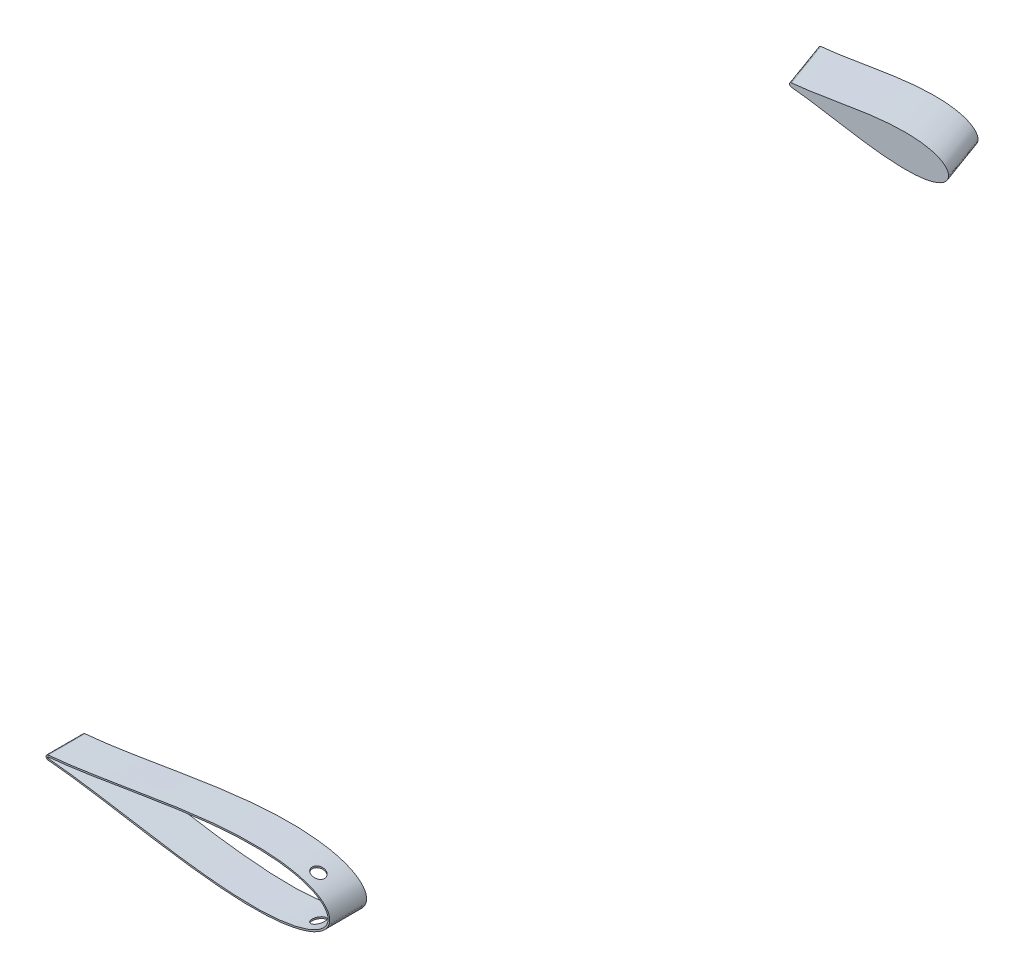
from build123d import *

# Parameters (mm, degrees)
BOSS_EXTRUDE1_DEPTH     = 50.8
BOSS_EXTRUDE2_DEPTH     = 38.1
CUT_EXTRUDE1_DEPTH      = 1080.51113169
CUT_EXTRUDE1_DEPTH_BACK = 1080.51113169
SKETCH17_R              = 6.35


with BuildPart() as part:
    # Sketch14 → Boss-Extrude1 (new, along a direction that is not the sketch's normal)
    with BuildSketch(Plane(origin=(0, 0, -947.42), x_dir=(-1, 0, 0), z_dir=(0, 0, -1))):
        with BuildLine():
            add(Edge.make_bspline(
                [(91.352087234, 1.49541842), (89.598575501, 1.641352156), (87.84757384, 1.812842005), (84.349691548, 2.189510256), (82.60270955, 2.394793371), (77.366117711, 3.048311358), (73.881345638, 3.534402047), (63.442435819, 5.077993959), (56.500977489, 6.219849924), (42.621199436, 8.523433908), (35.680956998, 9.687776942), (21.790883066, 11.873887804), (14.842692676, 12.896557742), (0.932047195, 14.623504691), (-6.03030017, 15.330186144), (-16.492434268, 15.974758747), (-19.982944122, 16.119712973), (-26.972274324, 16.224128381), (-30.471073998, 16.184051004), (-37.480122502, 15.848347235), (-40.990291409, 15.554504723), (-46.268500779, 14.824558439), (-48.030093019, 14.532381203), (-51.559091221, 13.818262461), (-53.332778194, 13.39435861), (-56.81146016, 12.38516863), (-58.523976644, 11.800078843), (-61.033001178, 10.743146143), (-61.860775343, 10.359638132), (-63.469588254, 9.525567587), (-64.252857703, 9.07430022), (-65.386488712, 8.330555883), (-65.757383951, 8.071333903), (-66.482980045, 7.526662589), (-66.838642257, 7.240627145), (-67.870162309, 6.339614528), (-68.503290084, 5.689498103), (-69.341767797, 4.613528965), (-69.603838166, 4.235106398), (-70.071556129, 3.453206694), (-70.277873939, 3.049537686), (-70.628606385, 2.21361134), (-70.773656939, 1.778714067), (-70.987538653, 0.887201521), (-71.055954682, 0.435999403), (-71.09733606, -0.249461), (-71.100793871, -0.479388301), (-71.087511786, -0.93348962), (-71.070859023, -1.159056852), (-70.991460569, -1.831396427), (-70.899187483, -2.273793723), (-70.640532758, -3.14760772), (-70.475581679, -3.572246507), (-70.088007778, -4.388992776), (-69.864686081, -4.783043296), (-69.116569875, -5.927296162), (-68.532975764, -6.614815004), (-67.572464514, -7.56238959), (-67.237640667, -7.864431581), (-66.543070745, -8.445017267), (-66.183270217, -8.72316135), (-65.08619603, -9.515199424), (-64.32647796, -9.992300117), (-62.765321419, -10.871520821), (-61.963717738, -11.273343914), (-60.327372807, -12.017434644), (-59.489741235, -12.360515785), (-57.80489415, -12.990962045), (-56.956987388, -13.278794674), (-54.399943476, -14.075736632), (-52.677619498, -14.518973377), (-49.207585255, -15.278633935), (-47.45976162, -15.594491432), (-43.944119467, -16.126325344), (-42.176307489, -16.342334436), (-38.624253029, -16.69227679), (-36.836817967, -16.826466647), (-31.489740778, -17.123805508), (-27.937606149, -17.184757259), (-20.851131898, -17.11253393), (-17.316850695, -16.978721535), (-6.733997676, -16.359205774), (0.294850171, -15.658332391), (14.323068904, -13.93501961), (21.322183333, -12.909782508), (35.307159142, -10.714729973), (42.292847895, -9.543501426), (56.266293626, -7.22367809), (63.254380531, -6.072666851), (73.762599821, -4.516381619), (77.269732876, -4.026286331), (82.542091663, -3.367220314), (84.301469316, -3.160156997), (87.823714895, -2.780379732), (89.586699962, -2.607549728), (91.352088815, -2.460626522)],
                knots=[0, 0, 0, 0, 0.015625, 0.015625, 0.03125, 0.03125, 0.0625, 0.0625, 0.125, 0.125, 0.1875, 0.1875, 0.25, 0.25, 0.3125, 0.3125, 0.34375, 0.34375, 0.375, 0.375, 0.40625, 0.40625, 0.421875, 0.421875, 0.4375, 0.4375, 0.453125, 0.453125, 0.4609375, 0.4609375, 0.46875, 0.46875, 0.47265625, 0.47265625, 0.4765625, 0.4765625, 0.484375, 0.484375, 0.48828125, 0.48828125, 0.4921875, 0.4921875, 0.49609375, 0.49609375, 0.5, 0.5, 0.501953125, 0.501953125, 0.50390625, 0.50390625, 0.5078125, 0.5078125, 0.51171875, 0.51171875, 0.515625, 0.515625, 0.5234375, 0.5234375, 0.52734375, 0.52734375, 0.53125, 0.53125, 0.5390625, 0.5390625, 0.546875, 0.546875, 0.5546875, 0.5546875, 0.5625, 0.5625, 0.578125, 0.578125, 0.59375, 0.59375, 0.609375, 0.609375, 0.625, 0.625, 0.65625, 0.65625, 0.6875, 0.6875, 0.75, 0.75, 0.8125, 0.8125, 0.875, 0.875, 0.9375, 0.9375, 0.96875, 0.96875, 0.984375, 0.984375, 1, 1, 1, 1], degree=3))
            add(Edge.make_bspline(
                [(91.352088815, -2.460626522), (91.601247742, -2.439890451), (91.849197057, -2.376468765), (92.18880923, -2.219052744), (92.298566645, -2.155739312), (92.503716216, -2.010702376), (92.598582666, -1.929649142), (92.772689152, -1.75024091), (92.852401369, -1.650826041), (92.989580407, -1.441620182), (93.047845804, -1.331306778), (93.143281403, -1.099011797), (93.179933567, -0.977495102), (93.22850444, -0.732835486), (93.240978628, -0.608480951), (93.240891061, -0.355480127), (93.228326558, -0.231145286), (93.179631515, 0.013317034), (93.142976371, 0.13463695), (93.047364892, 0.367010351), (92.989077395, 0.477174159), (92.852169859, 0.685818552), (92.772495618, 0.785201718), (92.59817063, 0.964768542), (92.5034611, 1.045594206), (92.299432218, 1.189904809), (92.189172384, 1.253624091), (91.962450056, 1.35875365), (91.845186395, 1.400916145), (91.602860105, 1.464452629), (91.47748787, 1.484982115), (91.352087234, 1.49541842)],
                knots=[0, 0, 0, 0, 0.125, 0.125, 0.1875, 0.1875, 0.25, 0.25, 0.3125, 0.3125, 0.375, 0.375, 0.4375, 0.4375, 0.5, 0.5, 0.5625, 0.5625, 0.625, 0.625, 0.6875, 0.6875, 0.75, 0.75, 0.8125, 0.8125, 0.875, 0.875, 0.9375, 0.9375, 1, 1, 1, 1], degree=3))
        make_face()
    extrude(amount=BOSS_EXTRUDE1_DEPTH, dir=(-0.34202014332566943, 0, -0.9396926207859082))


with BuildPart() as body_2:
    # Sketch16 → Boss-Extrude2 (new body)
    with BuildSketch(Plane.XY):
        with BuildLine():
            add(Edge.make_bspline(
                [(126.365289106, -2.776557685), (129.533195406, -3.039999805), (132.696832827, -3.349909436), (139.017244919, -4.030084797), (142.174533676, -4.400555914), (151.635672652, -5.581277396), (157.929755345, -6.459545262), (170.502922826, -8.318500411), (176.781776085, -9.300768785), (189.33176488, -11.318009225), (195.602945233, -12.353196054), (214.415538932, -15.475602914), (226.954876281, -17.579089337), (252.061956075, -21.526190816), (264.62941354, -23.372413076), (283.528249756, -25.705807947), (289.83584901, -26.41053343), (302.472548515, -27.623276975), (308.801627899, -28.13148593), (321.488293166, -28.887104763), (327.845831051, -29.134953757), (337.410880848, -29.243764762), (340.604060239, -29.235851542), (345.402366531, -29.145876878), (347.003231889, -29.102803264), (350.208087487, -28.988067245), (351.8124368, -28.916412441), (356.618340905, -28.655142936), (359.816519315, -28.419166413), (366.199054484, -27.798865851), (369.383411367, -27.414543141), (375.734902204, -26.461044365), (378.889840316, -25.893834969), (385.138376828, -24.529653187), (388.233406208, -23.733690042), (392.81539744, -22.3039193), (394.33257298, -21.787780403), (397.341884883, -20.657986295), (398.835193011, -20.043896325), (401.759152777, -18.706036944), (403.193526133, -17.981720223), (405.29083459, -16.786400085), (405.982303808, -16.368675404), (407.335989268, -15.496392815), (407.997647095, -15.042114637), (409.929580021, -13.615928339), (411.149105569, -12.583404835), (412.550174006, -11.145434664), (412.824077263, -10.850303438), (413.357840179, -10.243267277), (413.618133766, -9.930713918), (414.367024496, -8.976388176), (414.826521275, -8.315194202), (415.444344344, -7.278540815), (415.638340795, -6.925486931), (416.000182434, -6.202952749), (416.168649945, -5.831873173), (416.625348359, -4.704174857), (416.864670193, -3.936039024), (417.11718589, -2.757135142), (417.183369199, -2.359655948), (417.277848046, -1.555195949), (417.306168146, -1.147421147), (417.331406111, 0.07455601), (417.268822492, 0.868656829), (417.002632394, 2.430557035), (416.798379162, 3.19688277), (416.3924011, 4.325902031), (416.239698995, 4.700518075), (415.907808028, 5.431048376), (415.728471122, 5.787804936), (415.154114269, 6.834981146), (414.722878882, 7.502390368), (414.014880757, 8.464654095), (413.768663418, 8.778916419), (413.257411307, 9.395484919), (412.99201273, 9.698169953), (411.636056735, 11.167993887), (410.448798565, 12.218974516), (408.564510879, 13.669461782), (407.918719061, 14.131396723), (406.596151454, 15.017515557), (405.917562671, 15.442749606), (403.858717927, 16.659751369), (402.454280606, 17.393859781), (399.597885708, 18.746942463), (398.14572581, 19.365426542), (395.203279761, 20.510020756), (393.712920978, 21.035954915), (390.70042534, 22.010829941), (389.175817693, 22.460341364), (384.577889987, 23.705379764), (381.499752589, 24.394318076), (375.324802931, 25.56718905), (372.227906094, 26.050193278), (366.019425804, 26.854977547), (362.907805738, 27.176355687), (356.672517481, 27.686852163), (353.548837654, 27.875842759), (344.162576846, 28.275720541), (337.884924457, 28.32115946), (328.446017751, 28.143110327), (325.296308521, 28.042294715), (319.01174376, 27.769483533), (315.873942015, 27.597469422), (306.472184034, 26.988863989), (300.219806177, 26.460256932), (287.738352204, 25.217859119), (281.509303178, 24.503853081), (262.848148034, 22.155271774), (250.441855426, 20.315551274), (225.659016065, 16.399713896), (213.282778285, 14.321141556), (194.713663919, 11.241093422), (188.523166439, 10.220856456), (176.134542365, 8.2337803), (169.936465833, 7.266886467), (157.525568837, 5.437453024), (151.312951941, 4.573472608), (141.975067213, 3.41169221), (138.859231402, 3.047134526), (132.619207486, 2.377134804), (129.494429459, 2.071576746), (126.365289029, 1.811358381)],
                knots=[0, 0, 0, 0, 0.015625, 0.015625, 0.03125, 0.03125, 0.0625, 0.0625, 0.09375, 0.09375, 0.125, 0.125, 0.1875, 0.1875, 0.25, 0.25, 0.28125, 0.28125, 0.3125, 0.3125, 0.34375, 0.34375, 0.359375, 0.359375, 0.3671875, 0.3671875, 0.375, 0.375, 0.390625, 0.390625, 0.40625, 0.40625, 0.421875, 0.421875, 0.4375, 0.4375, 0.4453125, 0.4453125, 0.453125, 0.453125, 0.4609375, 0.4609375, 0.46484375, 0.46484375, 0.46875, 0.46875, 0.4765625, 0.4765625, 0.478515625, 0.478515625, 0.48046875, 0.48046875, 0.484375, 0.484375, 0.486328125, 0.486328125, 0.48828125, 0.48828125, 0.4921875, 0.4921875, 0.494140625, 0.494140625, 0.49609375, 0.49609375, 0.5, 0.5, 0.50390625, 0.50390625, 0.505859375, 0.505859375, 0.5078125, 0.5078125, 0.51171875, 0.51171875, 0.513671875, 0.513671875, 0.515625, 0.515625, 0.5234375, 0.5234375, 0.52734375, 0.52734375, 0.53125, 0.53125, 0.5390625, 0.5390625, 0.546875, 0.546875, 0.5546875, 0.5546875, 0.5625, 0.5625, 0.578125, 0.578125, 0.59375, 0.59375, 0.609375, 0.609375, 0.625, 0.625, 0.65625, 0.65625, 0.671875, 0.671875, 0.6875, 0.6875, 0.71875, 0.71875, 0.75, 0.75, 0.8125, 0.8125, 0.875, 0.875, 0.90625, 0.90625, 0.9375, 0.9375, 0.96875, 0.96875, 0.984375, 0.984375, 1, 1, 1, 1], degree=3))
            add(Edge.make_bspline(
                [(126.365289029, 1.811358381), (126.082445832, 1.787837226), (125.800752517, 1.709726316), (125.29039887, 1.460494173), (125.05556253, 1.286378206), (124.766818062, 0.973119594), (124.679275152, 0.858155233), (124.528023209, 0.615400299), (124.464404725, 0.488376051), (124.360685292, 0.223267924), (124.320505575, 0.083978407), (124.267260922, -0.196726404), (124.253681496, -0.33888649), (124.253718192, -0.62693294), (124.26733093, -0.768624911), (124.320161865, -1.047617863), (124.359843326, -1.186035748), (124.464042919, -1.452920662), (124.527732278, -1.579937653), (124.677909089, -1.821331957), (124.765533297, -1.936790461), (124.958780327, -2.146701121), (125.06429659, -2.241617512), (125.292743675, -2.411791159), (125.41663599, -2.487260057), (125.672311377, -2.612285902), (125.805074262, -2.662774505), (126.080651347, -2.739212523), (126.22295353, -2.764721102), (126.365289106, -2.776557685)],
                knots=[0, 0, 0, 0, 0.125, 0.125, 0.25, 0.25, 0.3125, 0.3125, 0.375, 0.375, 0.4375, 0.4375, 0.5, 0.5, 0.5625, 0.5625, 0.625, 0.625, 0.6875, 0.6875, 0.75, 0.75, 0.8125, 0.8125, 0.875, 0.875, 0.9375, 0.9375, 1, 1, 1, 1], degree=3))
        make_face()
        with BuildLine():
            ThreePointArc((126.496851059, 0.229317599), (125.841678869, -0.482600009), (126.496851077, -1.194517601))
            add(Edge.make_bspline(
                [(126.496851077, -1.194517601), (126.729706694, -1.213881784), (128.484555461, -1.361695883), (131.940515396, -1.681123472), (137.070377367, -2.214764149), (142.757988423, -2.869593043), (148.981968122, -3.649535708), (155.713278911, -4.555386266), (162.922811423, -5.585113831), (170.579345778, -6.733399419), (178.650368608, -7.992074339), (187.102067049, -9.349900248), (195.899513624, -10.79285267), (205.006767773, -12.304296227), (214.386992306, -13.865153344), (224.002515129, -15.454245854), (233.814891207, -17.048549245), (243.784934969, -18.623570085), (253.872741551, -20.15367614), (264.037688386, -21.612551356), (274.238439962, -22.973529753), (284.432937787, -24.210070717), (294.578393406, -25.296140455), (304.631281861, -26.206671723), (314.54734585, -26.917929489), (324.281596584, -27.407954765), (333.788323577, -27.656977764), (343.021110192, -27.647732596), (351.932818031, -27.365553121), (360.475586196, -26.799391147), (368.600692212, -25.94103677), (376.258474868, -24.78662084), (383.397870016, -23.335738401), (389.966063878, -21.59324438), (395.907528805, -19.569351107), (401.162992896, -17.282091813), (405.668634935, -14.761754902), (409.357142668, -12.059485448), (412.166405834, -9.263543434), (414.068321899, -6.521759489), (415.128883301, -4.048125246), (415.557158042, -2.063808477), (415.654701473, -0.4826), (415.557158042, 1.098608477), (415.128883301, 3.082925246), (414.068321899, 5.556559489), (412.166405834, 8.298343434), (409.357142668, 11.094285448), (405.668634935, 13.796554902), (401.162992896, 16.316891813), (395.907528805, 18.604151107), (389.966063878, 20.62804438), (383.397870016, 22.370538401), (376.258474868, 23.82142084), (368.600692212, 24.97583677), (360.475586196, 25.834191147), (351.932818031, 26.400353121), (343.021110192, 26.682532596), (333.788323577, 26.691777764), (324.281596584, 26.442754765), (314.54734585, 25.952729489), (304.631281861, 25.241471723), (294.578393406, 24.330940455), (284.432937787, 23.244870717), (274.238439962, 22.008329753), (264.037688386, 20.647351356), (253.872741551, 19.18847614), (243.784934969, 17.658370085), (233.814891207, 16.083349245), (224.002515129, 14.489045854), (214.386992306, 12.899953344), (205.006767773, 11.339096227), (195.899513624, 9.82765267), (187.102067049, 8.384700248), (178.650368608, 7.026874339), (170.579345778, 5.768199419), (162.922811423, 4.619913831), (155.713278911, 3.590186266), (148.981968122, 2.684335708), (142.757988423, 1.904393043), (137.070377367, 1.249564149), (131.940515396, 0.715923472), (128.484555455, 0.396495883), (126.729706683, 0.248681783), (126.496851059, 0.229317599)],
                knots=[0.020157042, 0.020157042, 0.020157042, 0.020157042, 0.021270888, 0.028552555, 0.036780684, 0.045920102, 0.055931764, 0.066772884, 0.07839713, 0.090754827, 0.103793165, 0.117456432, 0.131686226, 0.146421738, 0.161599998, 0.177156133, 0.193023668, 0.209134786, 0.225420633, 0.241811602, 0.258237647, 0.274628557, 0.290914287, 0.307025229, 0.322892517, 0.338448342, 0.353626207, 0.368361232, 0.382590428, 0.396252961, 0.409290412, 0.42164701, 0.433269881, 0.444109249, 0.45411864, 0.463255055, 0.471479114, 0.478755289, 0.485052318, 0.490344026, 0.494609833, 0.497833231, 0.5, 0.502166769, 0.505390167, 0.509655974, 0.514947682, 0.521244711, 0.528520886, 0.536744945, 0.54588136, 0.555890751, 0.566730119, 0.57835299, 0.590709588, 0.603747039, 0.617409572, 0.631638768, 0.646373793, 0.661551658, 0.677107483, 0.692974771, 0.709085713, 0.725371443, 0.741762353, 0.758188398, 0.774579367, 0.790865214, 0.806976332, 0.822843867, 0.838400002, 0.853578262, 0.868313774, 0.882543568, 0.896206835, 0.909245173, 0.92160287, 0.933227116, 0.944068236, 0.954079898, 0.963219316, 0.971447445, 0.978729112, 0.979842958, 0.979842958, 0.979842958, 0.979842958], degree=3))
        make_face(mode=Mode.SUBTRACT)
    extrude(amount=BOSS_EXTRUDE2_DEPTH)

    # Sketch17 → Cut-Extrude1 (cut, two sides: drawn at the far end of the back side and taken through both)
    with BuildSketch(Plane(origin=(0, 0, 0), x_dir=(1, 0, 0), z_dir=(0, 1, 0)).offset(-CUT_EXTRUDE1_DEPTH_BACK)):
        with Locations((391.155265209, -23.622)):
            Circle(SKETCH17_R)
        with Locations((40.502407565, 976.106385136)):
            Circle(SKETCH17_R)
    extrude(amount=CUT_EXTRUDE1_DEPTH + CUT_EXTRUDE1_DEPTH_BACK, mode=Mode.SUBTRACT)


solid = Compound([part.part, body_2.part])
